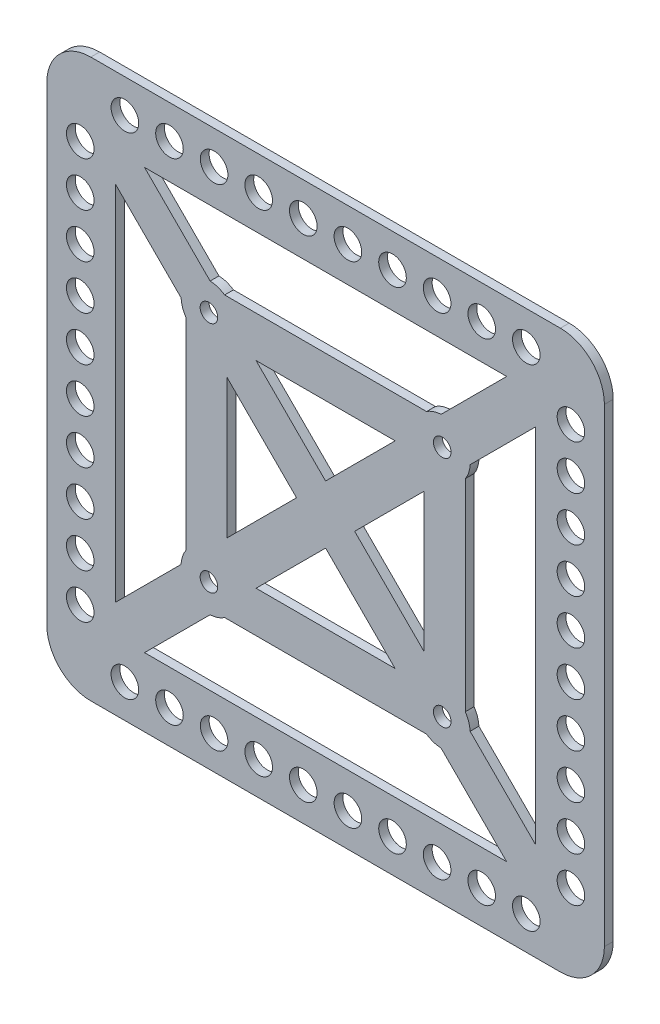
from build123d import *

# Parameters (mm, degrees)
SKETCH1_R              = 5.7
SKETCH1_R_2            = 4.7
BOSS_EXTRUDE1_DEPTH    = 16
BOSS_EXTRUDE1_2_DEPTH  = 16
BOSS_EXTRUDE1_3_DEPTH  = 16
BOSS_EXTRUDE1_4_DEPTH  = 16
BOSS_EXTRUDE1_5_DEPTH  = 16
BOSS_EXTRUDE1_6_DEPTH  = 16
BOSS_EXTRUDE1_7_DEPTH  = 16
BOSS_EXTRUDE1_8_DEPTH  = 16
BOSS_EXTRUDE1_9_DEPTH  = 16
BOSS_EXTRUDE1_10_DEPTH = 16
BOSS_EXTRUDE1_11_DEPTH = 16
BOSS_EXTRUDE1_12_DEPTH = 16
BOSS_EXTRUDE1_13_DEPTH = 16
BOSS_EXTRUDE1_14_DEPTH = 16
BOSS_EXTRUDE1_15_DEPTH = 16
BOSS_EXTRUDE1_16_DEPTH = 16
BOSS_EXTRUDE1_17_DEPTH = 16
BOSS_EXTRUDE1_18_DEPTH = 16
BOSS_EXTRUDE1_19_DEPTH = 16
BOSS_EXTRUDE1_20_DEPTH = 16
BOSS_EXTRUDE1_21_DEPTH = 16
BOSS_EXTRUDE1_22_DEPTH = 16
BOSS_EXTRUDE1_23_DEPTH = 16
BOSS_EXTRUDE1_24_DEPTH = 16
BOSS_EXTRUDE1_25_DEPTH = 16
BOSS_EXTRUDE1_26_DEPTH = 16
BOSS_EXTRUDE1_27_DEPTH = 16
BOSS_EXTRUDE1_28_DEPTH = 16
BOSS_EXTRUDE1_29_DEPTH = 16
BOSS_EXTRUDE1_30_DEPTH = 16
BOSS_EXTRUDE1_31_DEPTH = 16
BOSS_EXTRUDE1_32_DEPTH = 16
BOSS_EXTRUDE1_33_DEPTH = 16
BOSS_EXTRUDE1_34_DEPTH = 16
BOSS_EXTRUDE1_35_DEPTH = 16
BOSS_EXTRUDE1_36_DEPTH = 16
BOSS_EXTRUDE1_37_DEPTH = 16
BOSS_EXTRUDE1_38_DEPTH = 16
BOSS_EXTRUDE1_39_DEPTH = 16
BOSS_EXTRUDE1_40_DEPTH = 16
BOSS_EXTRUDE3_START    = -6
SKETCH4_W              = 190
SKETCH4_H              = 190
SKETCH4_R              = 4.7
BOSS_EXTRUDE3_DEPTH    = 6
SKETCH5_R              = 3
CUT_EXTRUDE1_DEPTH     = 6
CUT_EXTRUDE2_DEPTH     = 6
SKETCH8_R              = 9.5
SKETCH8_R_2            = 3
SKETCH8_R_3            = 3.109379702
BOSS_EXTRUDE4_DEPTH    = 6
FILLET1_R              = 15
SKETCH9_W              = 178.6
SKETCH9_H              = 16
CUT_EXTRUDE3_DEPTH     = 646.867446789
CUT_EXTRUDE4_DEPTH     = 3


with BuildPart() as part:
    # Sketch1 → Boss-Extrude1 (new body)
    with BuildSketch(Plane.XY):
        with Locations((453.680836538, -1249.606745703)):
            Circle(SKETCH1_R)
        with Locations((453.680836538, -1249.606745703)):
            Circle(SKETCH1_R_2, mode=Mode.SUBTRACT)
    extrude(amount=BOSS_EXTRUDE1_DEPTH)



with BuildPart() as body_2:
    # Sketch1 → Boss-Extrude1 2 (new body)
    with BuildSketch(Plane.XY):
        with Locations((468.880836538, -1249.606745703)):
            Circle(SKETCH1_R)
        with Locations((468.880836538, -1249.606745703)):
            Circle(SKETCH1_R_2, mode=Mode.SUBTRACT)
    extrude(amount=BOSS_EXTRUDE1_2_DEPTH)


with BuildPart() as body_3:
    # Sketch1 → Boss-Extrude1 3 (new body)
    with BuildSketch(Plane.XY):
        with Locations((484.080836538, -1249.606745703)):
            Circle(SKETCH1_R)
        with Locations((484.080836538, -1249.606745703)):
            Circle(SKETCH1_R_2, mode=Mode.SUBTRACT)
    extrude(amount=BOSS_EXTRUDE1_3_DEPTH)


with BuildPart() as body_4:
    # Sketch1 → Boss-Extrude1 4 (new body)
    with BuildSketch(Plane.XY):
        with Locations((499.280836538, -1249.606745703)):
            Circle(SKETCH1_R)
        with Locations((499.280836538, -1249.606745703)):
            Circle(SKETCH1_R_2, mode=Mode.SUBTRACT)
    extrude(amount=BOSS_EXTRUDE1_4_DEPTH)


with BuildPart() as body_5:
    # Sketch1 → Boss-Extrude1 5 (new body)
    with BuildSketch(Plane.XY):
        with Locations((514.480836538, -1249.606745703)):
            Circle(SKETCH1_R)
        with Locations((514.480836538, -1249.606745703)):
            Circle(SKETCH1_R_2, mode=Mode.SUBTRACT)
    extrude(amount=BOSS_EXTRUDE1_5_DEPTH)


with BuildPart() as body_6:
    # Sketch1 → Boss-Extrude1 6 (new body)
    with BuildSketch(Plane.XY):
        with Locations((529.680836538, -1249.606745703)):
            Circle(SKETCH1_R)
        with Locations((529.680836538, -1249.606745703)):
            Circle(SKETCH1_R_2, mode=Mode.SUBTRACT)
    extrude(amount=BOSS_EXTRUDE1_6_DEPTH)


with BuildPart() as body_7:
    # Sketch1 → Boss-Extrude1 7 (new body)
    with BuildSketch(Plane.XY):
        with Locations((544.880836538, -1249.606745703)):
            Circle(SKETCH1_R)
        with Locations((544.880836538, -1249.606745703)):
            Circle(SKETCH1_R_2, mode=Mode.SUBTRACT)
    extrude(amount=BOSS_EXTRUDE1_7_DEPTH)


with BuildPart() as body_8:
    # Sketch1 → Boss-Extrude1 8 (new body)
    with BuildSketch(Plane.XY):
        with Locations((560.080836538, -1249.606745703)):
            Circle(SKETCH1_R)
        with Locations((560.080836538, -1249.606745703)):
            Circle(SKETCH1_R_2, mode=Mode.SUBTRACT)
    extrude(amount=BOSS_EXTRUDE1_8_DEPTH)


with BuildPart() as body_9:
    # Sketch1 → Boss-Extrude1 9 (new body)
    with BuildSketch(Plane.XY):
        with Locations((575.280836538, -1249.606745703)):
            Circle(SKETCH1_R)
        with Locations((575.280836538, -1249.606745703)):
            Circle(SKETCH1_R_2, mode=Mode.SUBTRACT)
    extrude(amount=BOSS_EXTRUDE1_9_DEPTH)


with BuildPart() as body_10:
    # Sketch1 → Boss-Extrude1 10 (new body)
    with BuildSketch(Plane.XY):
        with Locations((590.480836538, -1249.606745703)):
            Circle(SKETCH1_R)
        with Locations((590.480836538, -1249.606745703)):
            Circle(SKETCH1_R_2, mode=Mode.SUBTRACT)
    extrude(amount=BOSS_EXTRUDE1_10_DEPTH)


with BuildPart() as body_11:
    # Sketch1 → Boss-Extrude1 11 (new body)
    with BuildSketch(Plane.XY):
        with Locations((438.480836538, -1264.806745703)):
            Circle(SKETCH1_R)
        with Locations((438.480836538, -1264.806745703)):
            Circle(SKETCH1_R_2, mode=Mode.SUBTRACT)
    extrude(amount=BOSS_EXTRUDE1_11_DEPTH)


with BuildPart() as body_12:
    # Sketch1 → Boss-Extrude1 12 (new body)
    with BuildSketch(Plane.XY):
        with Locations((438.480836538, -1280.006745703)):
            Circle(SKETCH1_R)
        with Locations((438.480836538, -1280.006745703)):
            Circle(SKETCH1_R_2, mode=Mode.SUBTRACT)
    extrude(amount=BOSS_EXTRUDE1_12_DEPTH)


with BuildPart() as body_13:
    # Sketch1 → Boss-Extrude1 13 (new body)
    with BuildSketch(Plane.XY):
        with Locations((438.480836538, -1295.206745703)):
            Circle(SKETCH1_R)
        with Locations((438.480836538, -1295.206745703)):
            Circle(SKETCH1_R_2, mode=Mode.SUBTRACT)
    extrude(amount=BOSS_EXTRUDE1_13_DEPTH)


with BuildPart() as body_14:
    # Sketch1 → Boss-Extrude1 14 (new body)
    with BuildSketch(Plane.XY):
        with Locations((438.480836538, -1310.406745703)):
            Circle(SKETCH1_R)
        with Locations((438.480836538, -1310.406745703)):
            Circle(SKETCH1_R_2, mode=Mode.SUBTRACT)
    extrude(amount=BOSS_EXTRUDE1_14_DEPTH)


with BuildPart() as body_15:
    # Sketch1 → Boss-Extrude1 15 (new body)
    with BuildSketch(Plane.XY):
        with Locations((438.480836538, -1325.606745703)):
            Circle(SKETCH1_R)
        with Locations((438.480836538, -1325.606745703)):
            Circle(SKETCH1_R_2, mode=Mode.SUBTRACT)
    extrude(amount=BOSS_EXTRUDE1_15_DEPTH)


with BuildPart() as body_16:
    # Sketch1 → Boss-Extrude1 16 (new body)
    with BuildSketch(Plane.XY):
        with Locations((438.480836538, -1340.806745703)):
            Circle(SKETCH1_R)
        with Locations((438.480836538, -1340.806745703)):
            Circle(SKETCH1_R_2, mode=Mode.SUBTRACT)
    extrude(amount=BOSS_EXTRUDE1_16_DEPTH)


with BuildPart() as body_17:
    # Sketch1 → Boss-Extrude1 17 (new body)
    with BuildSketch(Plane.XY):
        with Locations((438.480836538, -1356.006745703)):
            Circle(SKETCH1_R)
        with Locations((438.480836538, -1356.006745703)):
            Circle(SKETCH1_R_2, mode=Mode.SUBTRACT)
    extrude(amount=BOSS_EXTRUDE1_17_DEPTH)


with BuildPart() as body_18:
    # Sketch1 → Boss-Extrude1 18 (new body)
    with BuildSketch(Plane.XY):
        with Locations((438.480836538, -1371.206745703)):
            Circle(SKETCH1_R)
        with Locations((438.480836538, -1371.206745703)):
            Circle(SKETCH1_R_2, mode=Mode.SUBTRACT)
    extrude(amount=BOSS_EXTRUDE1_18_DEPTH)


with BuildPart() as body_19:
    # Sketch1 → Boss-Extrude1 19 (new body)
    with BuildSketch(Plane.XY):
        with Locations((438.480836538, -1386.406745703)):
            Circle(SKETCH1_R)
        with Locations((438.480836538, -1386.406745703)):
            Circle(SKETCH1_R_2, mode=Mode.SUBTRACT)
    extrude(amount=BOSS_EXTRUDE1_19_DEPTH)


with BuildPart() as body_20:
    # Sketch1 → Boss-Extrude1 20 (new body)
    with BuildSketch(Plane.XY):
        with Locations((438.480836538, -1401.606745703)):
            Circle(SKETCH1_R)
        with Locations((438.480836538, -1401.606745703)):
            Circle(SKETCH1_R_2, mode=Mode.SUBTRACT)
    extrude(amount=BOSS_EXTRUDE1_20_DEPTH)


with BuildPart() as body_21:
    # Sketch1 → Boss-Extrude1 21 (new body)
    with BuildSketch(Plane.XY):
        with Locations((453.680836538, -1416.806745703)):
            Circle(SKETCH1_R)
        with Locations((453.680836538, -1416.806745703)):
            Circle(SKETCH1_R_2, mode=Mode.SUBTRACT)
    extrude(amount=BOSS_EXTRUDE1_21_DEPTH)


with BuildPart() as body_22:
    # Sketch1 → Boss-Extrude1 22 (new body)
    with BuildSketch(Plane.XY):
        with Locations((468.880836538, -1416.806745703)):
            Circle(SKETCH1_R)
        with Locations((468.880836538, -1416.806745703)):
            Circle(SKETCH1_R_2, mode=Mode.SUBTRACT)
    extrude(amount=BOSS_EXTRUDE1_22_DEPTH)


with BuildPart() as body_23:
    # Sketch1 → Boss-Extrude1 23 (new body)
    with BuildSketch(Plane.XY):
        with Locations((484.080836538, -1416.806745703)):
            Circle(SKETCH1_R)
        with Locations((484.080836538, -1416.806745703)):
            Circle(SKETCH1_R_2, mode=Mode.SUBTRACT)
    extrude(amount=BOSS_EXTRUDE1_23_DEPTH)


with BuildPart() as body_24:
    # Sketch1 → Boss-Extrude1 24 (new body)
    with BuildSketch(Plane.XY):
        with Locations((499.280836538, -1416.806745703)):
            Circle(SKETCH1_R)
        with Locations((499.280836538, -1416.806745703)):
            Circle(SKETCH1_R_2, mode=Mode.SUBTRACT)
    extrude(amount=BOSS_EXTRUDE1_24_DEPTH)


with BuildPart() as body_25:
    # Sketch1 → Boss-Extrude1 25 (new body)
    with BuildSketch(Plane.XY):
        with Locations((514.480836538, -1416.806745703)):
            Circle(SKETCH1_R)
        with Locations((514.480836538, -1416.806745703)):
            Circle(SKETCH1_R_2, mode=Mode.SUBTRACT)
    extrude(amount=BOSS_EXTRUDE1_25_DEPTH)


with BuildPart() as body_26:
    # Sketch1 → Boss-Extrude1 26 (new body)
    with BuildSketch(Plane.XY):
        with Locations((529.680836538, -1416.806745703)):
            Circle(SKETCH1_R)
        with Locations((529.680836538, -1416.806745703)):
            Circle(SKETCH1_R_2, mode=Mode.SUBTRACT)
    extrude(amount=BOSS_EXTRUDE1_26_DEPTH)


with BuildPart() as body_27:
    # Sketch1 → Boss-Extrude1 27 (new body)
    with BuildSketch(Plane.XY):
        with Locations((544.880836538, -1416.806745703)):
            Circle(SKETCH1_R)
        with Locations((544.880836538, -1416.806745703)):
            Circle(SKETCH1_R_2, mode=Mode.SUBTRACT)
    extrude(amount=BOSS_EXTRUDE1_27_DEPTH)


with BuildPart() as body_28:
    # Sketch1 → Boss-Extrude1 28 (new body)
    with BuildSketch(Plane.XY):
        with Locations((560.080836538, -1416.806745703)):
            Circle(SKETCH1_R)
        with Locations((560.080836538, -1416.806745703)):
            Circle(SKETCH1_R_2, mode=Mode.SUBTRACT)
    extrude(amount=BOSS_EXTRUDE1_28_DEPTH)


with BuildPart() as body_29:
    # Sketch1 → Boss-Extrude1 29 (new body)
    with BuildSketch(Plane.XY):
        with Locations((575.280836538, -1416.806745703)):
            Circle(SKETCH1_R)
        with Locations((575.280836538, -1416.806745703)):
            Circle(SKETCH1_R_2, mode=Mode.SUBTRACT)
    extrude(amount=BOSS_EXTRUDE1_29_DEPTH)


with BuildPart() as body_30:
    # Sketch1 → Boss-Extrude1 30 (new body)
    with BuildSketch(Plane.XY):
        with Locations((590.480836538, -1416.806745703)):
            Circle(SKETCH1_R)
        with Locations((590.480836538, -1416.806745703)):
            Circle(SKETCH1_R_2, mode=Mode.SUBTRACT)
    extrude(amount=BOSS_EXTRUDE1_30_DEPTH)


with BuildPart() as body_31:
    # Sketch1 → Boss-Extrude1 31 (new body)
    with BuildSketch(Plane.XY):
        with Locations((605.680836538, -1264.806745703)):
            Circle(SKETCH1_R)
        with Locations((605.680836538, -1264.806745703)):
            Circle(SKETCH1_R_2, mode=Mode.SUBTRACT)
    extrude(amount=BOSS_EXTRUDE1_31_DEPTH)


with BuildPart() as body_32:
    # Sketch1 → Boss-Extrude1 32 (new body)
    with BuildSketch(Plane.XY):
        with Locations((605.680836538, -1280.006745703)):
            Circle(SKETCH1_R)
        with Locations((605.680836538, -1280.006745703)):
            Circle(SKETCH1_R_2, mode=Mode.SUBTRACT)
    extrude(amount=BOSS_EXTRUDE1_32_DEPTH)


with BuildPart() as body_33:
    # Sketch1 → Boss-Extrude1 33 (new body)
    with BuildSketch(Plane.XY):
        with Locations((605.680836538, -1295.206745703)):
            Circle(SKETCH1_R)
        with Locations((605.680836538, -1295.206745703)):
            Circle(SKETCH1_R_2, mode=Mode.SUBTRACT)
    extrude(amount=BOSS_EXTRUDE1_33_DEPTH)


with BuildPart() as body_34:
    # Sketch1 → Boss-Extrude1 34 (new body)
    with BuildSketch(Plane.XY):
        with Locations((605.680836538, -1310.406745703)):
            Circle(SKETCH1_R)
        with Locations((605.680836538, -1310.406745703)):
            Circle(SKETCH1_R_2, mode=Mode.SUBTRACT)
    extrude(amount=BOSS_EXTRUDE1_34_DEPTH)


with BuildPart() as body_35:
    # Sketch1 → Boss-Extrude1 35 (new body)
    with BuildSketch(Plane.XY):
        with Locations((605.680836538, -1325.606745703)):
            Circle(SKETCH1_R)
        with Locations((605.680836538, -1325.606745703)):
            Circle(SKETCH1_R_2, mode=Mode.SUBTRACT)
    extrude(amount=BOSS_EXTRUDE1_35_DEPTH)


with BuildPart() as body_36:
    # Sketch1 → Boss-Extrude1 36 (new body)
    with BuildSketch(Plane.XY):
        with Locations((605.680836538, -1340.806745703)):
            Circle(SKETCH1_R)
        with Locations((605.680836538, -1340.806745703)):
            Circle(SKETCH1_R_2, mode=Mode.SUBTRACT)
    extrude(amount=BOSS_EXTRUDE1_36_DEPTH)


with BuildPart() as body_37:
    # Sketch1 → Boss-Extrude1 37 (new body)
    with BuildSketch(Plane.XY):
        with Locations((605.680836538, -1356.006745703)):
            Circle(SKETCH1_R)
        with Locations((605.680836538, -1356.006745703)):
            Circle(SKETCH1_R_2, mode=Mode.SUBTRACT)
    extrude(amount=BOSS_EXTRUDE1_37_DEPTH)


with BuildPart() as body_38:
    # Sketch1 → Boss-Extrude1 38 (new body)
    with BuildSketch(Plane.XY):
        with Locations((605.680836538, -1371.206745703)):
            Circle(SKETCH1_R)
        with Locations((605.680836538, -1371.206745703)):
            Circle(SKETCH1_R_2, mode=Mode.SUBTRACT)
    extrude(amount=BOSS_EXTRUDE1_38_DEPTH)


with BuildPart() as body_39:
    # Sketch1 → Boss-Extrude1 39 (new body)
    with BuildSketch(Plane.XY):
        with Locations((605.680836538, -1386.406745703)):
            Circle(SKETCH1_R)
        with Locations((605.680836538, -1386.406745703)):
            Circle(SKETCH1_R_2, mode=Mode.SUBTRACT)
    extrude(amount=BOSS_EXTRUDE1_39_DEPTH)


with BuildPart() as body_40:
    # Sketch1 → Boss-Extrude1 40 (new body)
    with BuildSketch(Plane.XY):
        with Locations((605.680836538, -1401.606745703)):
            Circle(SKETCH1_R)
        with Locations((605.680836538, -1401.606745703)):
            Circle(SKETCH1_R_2, mode=Mode.SUBTRACT)
    extrude(amount=BOSS_EXTRUDE1_40_DEPTH)


with BuildPart() as part_1:
    add(part.part)

    add(body_2.part)  # Boss-Extrude3 merges body 2

    add(body_3.part)  # Boss-Extrude3 merges body 3

    add(body_4.part)  # Boss-Extrude3 merges body 4

    add(body_5.part)  # Boss-Extrude3 merges body 5

    add(body_6.part)  # Boss-Extrude3 merges body 6

    add(body_7.part)  # Boss-Extrude3 merges body 7

    add(body_8.part)  # Boss-Extrude3 merges body 8

    add(body_9.part)  # Boss-Extrude3 merges body 9

    add(body_10.part)  # Boss-Extrude3 merges body 10

    add(body_11.part)  # Boss-Extrude3 merges body 11

    add(body_12.part)  # Boss-Extrude3 merges body 12

    add(body_13.part)  # Boss-Extrude3 merges body 13

    add(body_14.part)  # Boss-Extrude3 merges body 14

    add(body_15.part)  # Boss-Extrude3 merges body 15

    add(body_16.part)  # Boss-Extrude3 merges body 16

    add(body_17.part)  # Boss-Extrude3 merges body 17

    add(body_18.part)  # Boss-Extrude3 merges body 18

    add(body_19.part)  # Boss-Extrude3 merges body 19

    add(body_20.part)  # Boss-Extrude3 merges body 20

    add(body_21.part)  # Boss-Extrude3 merges body 21

    add(body_22.part)  # Boss-Extrude3 merges body 22

    add(body_23.part)  # Boss-Extrude3 merges body 23

    add(body_24.part)  # Boss-Extrude3 merges body 24

    add(body_25.part)  # Boss-Extrude3 merges body 25

    add(body_26.part)  # Boss-Extrude3 merges body 26

    add(body_27.part)  # Boss-Extrude3 merges body 27

    add(body_28.part)  # Boss-Extrude3 merges body 28

    add(body_29.part)  # Boss-Extrude3 merges body 29

    add(body_30.part)  # Boss-Extrude3 merges body 30

    add(body_31.part)  # Boss-Extrude3 merges body 31

    add(body_32.part)  # Boss-Extrude3 merges body 32

    add(body_33.part)  # Boss-Extrude3 merges body 33

    add(body_34.part)  # Boss-Extrude3 merges body 34

    add(body_35.part)  # Boss-Extrude3 merges body 35

    add(body_36.part)  # Boss-Extrude3 merges body 36

    add(body_37.part)  # Boss-Extrude3 merges body 37

    add(body_38.part)  # Boss-Extrude3 merges body 38

    add(body_39.part)  # Boss-Extrude3 merges body 39

    add(body_40.part)  # Boss-Extrude3 merges body 40
    # Sketch4 → Boss-Extrude3 (add)
    with BuildSketch(Plane.XY.offset(BOSS_EXTRUDE3_START)):
        with Locations((522.080836538, -1333.206745703)):
            Rectangle(SKETCH4_W, SKETCH4_H)
        with Locations((438.480836538, -1264.806745703)):
            Circle(SKETCH4_R, mode=Mode.SUBTRACT)
        with Locations((438.480836538, -1280.006745703)):
            Circle(SKETCH4_R, mode=Mode.SUBTRACT)
        with Locations((438.480836538, -1295.206745703)):
            Circle(SKETCH4_R, mode=Mode.SUBTRACT)
        with Locations((438.480836538, -1310.406745703)):
            Circle(SKETCH4_R, mode=Mode.SUBTRACT)
        with Locations((438.480836538, -1325.606745703)):
            Circle(SKETCH4_R, mode=Mode.SUBTRACT)
        with Locations((438.480836538, -1340.806745703)):
            Circle(SKETCH4_R, mode=Mode.SUBTRACT)
        with Locations((438.480836538, -1356.006745703)):
            Circle(SKETCH4_R, mode=Mode.SUBTRACT)
        with Locations((438.480836538, -1371.206745703)):
            Circle(SKETCH4_R, mode=Mode.SUBTRACT)
        with Locations((438.480836538, -1386.406745703)):
            Circle(SKETCH4_R, mode=Mode.SUBTRACT)
        with Locations((438.480836538, -1401.606745703)):
            Circle(SKETCH4_R, mode=Mode.SUBTRACT)
        with Locations((453.680836538, -1416.806745703)):
            Circle(SKETCH4_R, mode=Mode.SUBTRACT)
        with Locations((468.880836538, -1416.806745703)):
            Circle(SKETCH4_R, mode=Mode.SUBTRACT)
        with Locations((484.080836538, -1416.806745703)):
            Circle(SKETCH4_R, mode=Mode.SUBTRACT)
        with Locations((499.280836538, -1416.806745703)):
            Circle(SKETCH4_R, mode=Mode.SUBTRACT)
        with Locations((514.480836538, -1416.806745703)):
            Circle(SKETCH4_R, mode=Mode.SUBTRACT)
        with Locations((529.680836538, -1416.806745703)):
            Circle(SKETCH4_R, mode=Mode.SUBTRACT)
        with Locations((544.880836538, -1416.806745703)):
            Circle(SKETCH4_R, mode=Mode.SUBTRACT)
        with Locations((560.080836538, -1416.806745703)):
            Circle(SKETCH4_R, mode=Mode.SUBTRACT)
        with Locations((575.280836538, -1416.806745703)):
            Circle(SKETCH4_R, mode=Mode.SUBTRACT)
        with Locations((590.480836538, -1416.806745703)):
            Circle(SKETCH4_R, mode=Mode.SUBTRACT)
        with Locations((605.680836538, -1401.606745703)):
            Circle(SKETCH4_R, mode=Mode.SUBTRACT)
        with Locations((605.680836538, -1386.406745703)):
            Circle(SKETCH4_R, mode=Mode.SUBTRACT)
        with Locations((605.680836538, -1371.206745703)):
            Circle(SKETCH4_R, mode=Mode.SUBTRACT)
        with Locations((605.680836538, -1356.006745703)):
            Circle(SKETCH4_R, mode=Mode.SUBTRACT)
        with Locations((605.680836538, -1340.806745703)):
            Circle(SKETCH4_R, mode=Mode.SUBTRACT)
        with Locations((605.680836538, -1325.606745703)):
            Circle(SKETCH4_R, mode=Mode.SUBTRACT)
        with Locations((605.680836538, -1310.406745703)):
            Circle(SKETCH4_R, mode=Mode.SUBTRACT)
        with Locations((605.680836538, -1295.206745703)):
            Circle(SKETCH4_R, mode=Mode.SUBTRACT)
        with Locations((605.680836538, -1280.006745703)):
            Circle(SKETCH4_R, mode=Mode.SUBTRACT)
        with Locations((605.680836538, -1264.806745703)):
            Circle(SKETCH4_R, mode=Mode.SUBTRACT)
        with Locations((590.480836538, -1249.606745703)):
            Circle(SKETCH4_R, mode=Mode.SUBTRACT)
        with Locations((575.280836538, -1249.606745703)):
            Circle(SKETCH4_R, mode=Mode.SUBTRACT)
        with Locations((560.080836538, -1249.606745703)):
            Circle(SKETCH4_R, mode=Mode.SUBTRACT)
        with Locations((544.880836538, -1249.606745703)):
            Circle(SKETCH4_R, mode=Mode.SUBTRACT)
        with Locations((529.680836538, -1249.606745703)):
            Circle(SKETCH4_R, mode=Mode.SUBTRACT)
        with Locations((514.480836538, -1249.606745703)):
            Circle(SKETCH4_R, mode=Mode.SUBTRACT)
        with Locations((499.280836538, -1249.606745703)):
            Circle(SKETCH4_R, mode=Mode.SUBTRACT)
        with Locations((484.080836538, -1249.606745703)):
            Circle(SKETCH4_R, mode=Mode.SUBTRACT)
        with Locations((468.880836538, -1249.606745703)):
            Circle(SKETCH4_R, mode=Mode.SUBTRACT)
        with Locations((453.680836538, -1249.606745703)):
            Circle(SKETCH4_R, mode=Mode.SUBTRACT)
    extrude(amount=BOSS_EXTRUDE3_DEPTH)

    # Sketch5 → Cut-Extrude1 (cut)
    with BuildSketch(Plane.XY):
        with Locations((482.330836538, -1293.456745703)):
            Circle(SKETCH5_R)
        with Locations((561.830836538, -1293.456745703)):
            Circle(SKETCH5_R)
        with Locations((561.830836538, -1372.956745703)):
            Circle(SKETCH5_R)
        with Locations((482.330836538, -1372.956745703)):
            Circle(SKETCH5_R)
    extrude(amount=-CUT_EXTRUDE1_DEPTH, mode=Mode.SUBTRACT)

    # Sketch7 → Cut-Extrude2 (cut)
    with BuildSketch(Plane(origin=(0, 0, -6), x_dir=(-1, 0, 0), z_dir=(0, 0, -1))):
        Polygon((-559.781341601, -1380.806745703), (-583.781341601, -1404.806745703), (-460.380331474, -1404.806745703), (-484.380331474, -1380.806745703), align=None)
        Polygon((-522.080836538, -1343.10624064), (-545.781341601, -1366.806745703), (-498.380331474, -1366.806745703), align=None)
        Polygon((-593.680836538, -1271.50624064), (-593.680836538, -1394.907250767), (-569.680836538, -1370.907250767), (-569.680836538, -1295.50624064), align=None)
        Polygon((-474.480836538, -1370.907250767), (-450.480836538, -1394.907250767), (-450.480836538, -1271.50624064), (-474.480836538, -1295.50624064), align=None)
        Polygon((-488.480836538, -1309.50624064), (-512.181341601, -1333.206745703), (-488.480836538, -1356.907250767), align=None)
        Polygon((-555.680836538, -1356.907250767), (-531.980331474, -1333.206745703), (-555.680836538, -1309.50624064), align=None)
        Polygon((-545.781341601, -1299.606745703), (-522.080836538, -1323.307250767), (-498.380331474, -1299.606745703), align=None)
        Polygon((-460.380331474, -1261.606745703), (-583.781341601, -1261.606745703), (-559.781341601, -1285.606745703), (-484.380331474, -1285.606745703), align=None)
    extrude(amount=-CUT_EXTRUDE2_DEPTH, mode=Mode.SUBTRACT)

    # Sketch8 → Boss-Extrude4 (add)
    # profile 1 of 4: a face of its own
    with BuildSketch(Plane.XY):
        with Locations((482.330836538, -1372.956745703)):
            Circle(SKETCH8_R)
        with Locations((482.330836538, -1372.956745703)):
            Circle(SKETCH8_R_2, mode=Mode.SUBTRACT)
    # profile 2 of 4: a face of its own
    with BuildSketch(Plane.XY):
        with Locations((561.830836538, -1372.956745703)):
            Circle(SKETCH8_R)
        with Locations((561.830836538, -1372.956745703)):
            Circle(SKETCH8_R_2, mode=Mode.SUBTRACT)
    # profile 3 of 4: a face of its own
    with BuildSketch(Plane.XY):
        with Locations((561.830836538, -1293.456745703)):
            Circle(SKETCH8_R)
        with Locations((561.830836538, -1293.456745703)):
            Circle(SKETCH8_R_3, mode=Mode.SUBTRACT)
    # profile 4 of 4: a face of its own
    with BuildSketch(Plane.XY):
        with Locations((482.330836538, -1293.456745703)):
            Circle(SKETCH8_R)
        with Locations((482.330836538, -1293.456745703)):
            Circle(SKETCH8_R_2, mode=Mode.SUBTRACT)
    extrude(amount=-BOSS_EXTRUDE4_DEPTH)

    # Fillet1
    fillet1_edges = [part_1.edges().sort_by_distance(p)[0] for p in [
        (617.080836538, -1428.206745703, -3),
        (427.080836538, -1428.206745703, -3),
        (427.080836538, -1238.206745703, -3),
        (617.080836538, -1238.206745703, -3),
    ]]
    fillet(fillet1_edges, radius=FILLET1_R)

    # Sketch9 → Cut-Extrude3 (cut, through all)
    with BuildSketch(Plane(origin=(0, -1238.206745703, 0), x_dir=(1, 0, 0), z_dir=(0, 1, 0))):
        with Locations((522.080836538, -8)):
            Rectangle(SKETCH9_W, SKETCH9_H)
    extrude(amount=-CUT_EXTRUDE3_DEPTH, mode=Mode.SUBTRACT)

    # Sketch10 → Cut-Extrude4 (cut)
    with BuildSketch(Plane.XY):
        with BuildLine():
            Line((602.080836538, -1238.206745703), (442.080836538, -1238.206745703))
            ThreePointArc((442.080836538, -1238.206745703), (431.47423482, -1242.600143986), (427.080836538, -1253.206745703))
            Line((427.080836538, -1253.206745703), (427.080836538, -1413.206745703))
            ThreePointArc((427.080836538, -1413.206745703), (431.47423482, -1423.813347421), (442.080836538, -1428.206745703))
            Line((442.080836538, -1428.206745703), (602.080836538, -1428.206745703))
            ThreePointArc((602.080836538, -1428.206745703), (612.687438256, -1423.813347421), (617.080836538, -1413.206745703))
            Line((617.080836538, -1413.206745703), (617.080836538, -1253.206745703))
            ThreePointArc((617.080836538, -1253.206745703), (612.687438256, -1242.600143986), (602.080836538, -1238.206745703))
        make_face()
    extrude(amount=-CUT_EXTRUDE4_DEPTH, mode=Mode.SUBTRACT)


solid = part_1.part
